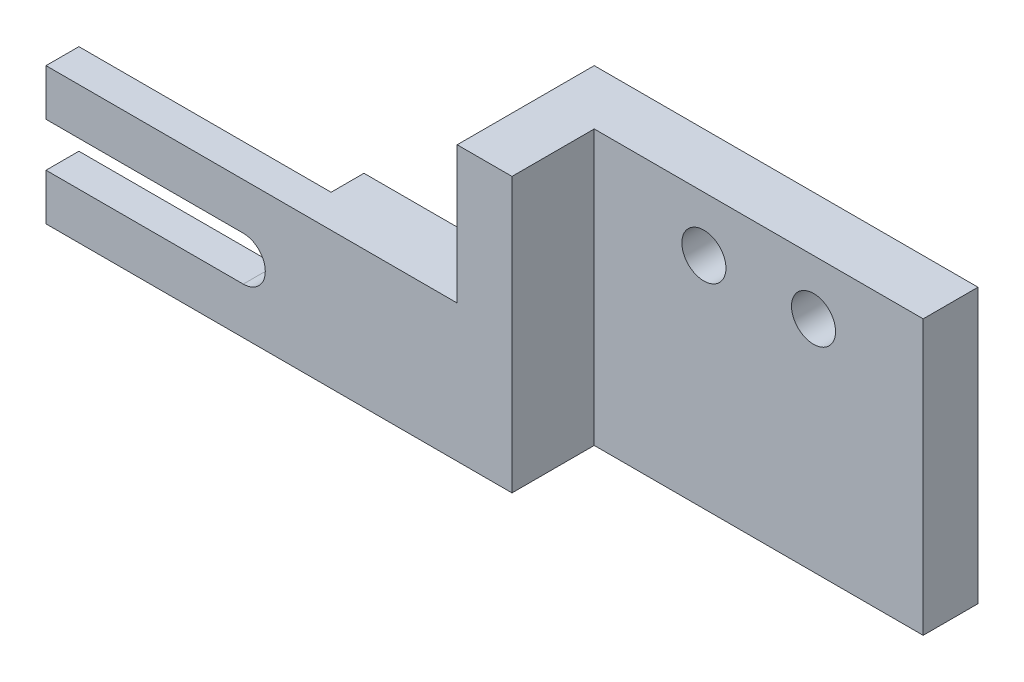
from build123d import *

# Parameters (mm, degrees)
SKETCH1_W                        = 92.075
SKETCH1_H                        = 15.875
BOSS_EXTRUDE1_DEPTH              = 15.875
SKETCH2_W                        = 47.625
SKETCH2_H                        = 15.875
CUT_EXTRUDE1_DEPTH               = 52.219943931
F_10_0_1935_DIAMETER_HOLE1_D     = 5.1054
F_10_START                       = -7.9375
F_10_0_1935_DIAMETER_SLOT1_DEPTH = 15.875
CUT_EXTRUDE2_REACH               = 51.34
SKETCH7_W                        = 47.625
SKETCH7_H                        = 12.065
CUT_EXTRUDE3_REACH               = 58.485
SKETCH8_W                        = 38.1
SKETCH8_H                        = 9.525
SKETCH9_W                        = 18.415
SKETCH9_H                        = 15.875
BOSS_EXTRUDE2_DEPTH              = 3.81


# Read off the part's stored shape, not the designer's step: #10 (0.1935) Diameter Slot1
with BuildPart() as part:
    # Sketch1 → Boss-Extrude1 (new, symmetric)
    with BuildSketch(Plane(origin=(0, 0, 0), x_dir=(1, 0, 0), z_dir=(0, 1, 0))):
        Rectangle(SKETCH1_W, SKETCH1_H)
    extrude(amount=BOSS_EXTRUDE1_DEPTH, both=True)

    # Sketch2 → Cut-Extrude1 (cut, through all)
    with BuildSketch(Plane.XY.offset(7.9375)):
        with Locations((-22.225, 7.9375)):
            Rectangle(SKETCH2_W, SKETCH2_H)
    extrude(amount=-CUT_EXTRUDE1_DEPTH, mode=Mode.SUBTRACT)

    # #10 (0.1935) Diameter Hole1 (through all)
    with Locations(Plane.XY.offset(7.9375)):
        with Locations((33.3375, 9.525), (20.6375, 9.525)):
            Hole(F_10_0_1935_DIAMETER_HOLE1_D / 2)

    # #10 (0.1935) Diameter Slot1 outline → #10 (0.1935) Diameter Slot1 (cut)
    with BuildSketch(Plane.XY.offset(F_10_START)):
        with BuildLine():
            ThreePointArc((-23.1902, -10.4902), (-20.6375, -7.9375), (-23.1902, -5.3848))
            Line((-23.1902, -5.3848), (-46.0375, -5.3848))
            Line((-46.0375, -5.3848), (-46.0375, -10.4902))
            Line((-46.0375, -10.4902), (-23.1902, -10.4902))
        make_face()
    extrude(amount=F_10_0_1935_DIAMETER_SLOT1_DEPTH, mode=Mode.SUBTRACT)

    # Sketch7 → Cut-Extrude2 (cut, up to next)
    with BuildSketch(Plane(origin=(0, 0, 0), x_dir=(1, 0, 0), z_dir=(0, 1, 0)), mode=Mode.PRIVATE) as cut_extrude2_sk1:
        with Locations((-22.225, 1.905)):
            Rectangle(SKETCH7_W, SKETCH7_H)
    cut_extrude2_tool1 = extrude(cut_extrude2_sk1.sketch, amount=-CUT_EXTRUDE2_REACH, mode=Mode.PRIVATE) & part.part
    add(cut_extrude2_tool1.solids().sort_by_distance((-22.225, 0, -1.905))[0], mode=Mode.SUBTRACT)

    # Sketch8 → Cut-Extrude3 (cut, up to next)
    with BuildSketch(Plane(origin=(0, 15.875, 0), x_dir=(1, 0, 0), z_dir=(0, 1, 0)), mode=Mode.PRIVATE) as cut_extrude3_sk1:
        with Locations((26.9875, -3.175)):
            Rectangle(SKETCH8_W, SKETCH8_H)
    cut_extrude3_tool1 = extrude(cut_extrude3_sk1.sketch, amount=-CUT_EXTRUDE3_REACH, mode=Mode.PRIVATE) & part.part
    add(cut_extrude3_tool1.solids().sort_by_distance((26.9875, 15.875, 3.175))[0], mode=Mode.SUBTRACT)

    # Sketch9 → Boss-Extrude2 (add)
    with BuildSketch(Plane(origin=(0, 0, 4.1275), x_dir=(-1, 0, 0), z_dir=(0, 0, -1))):
        with Locations((7.62, -7.9375)):
            Rectangle(SKETCH9_W, SKETCH9_H)
    extrude(amount=BOSS_EXTRUDE2_DEPTH)


solid = part.part
